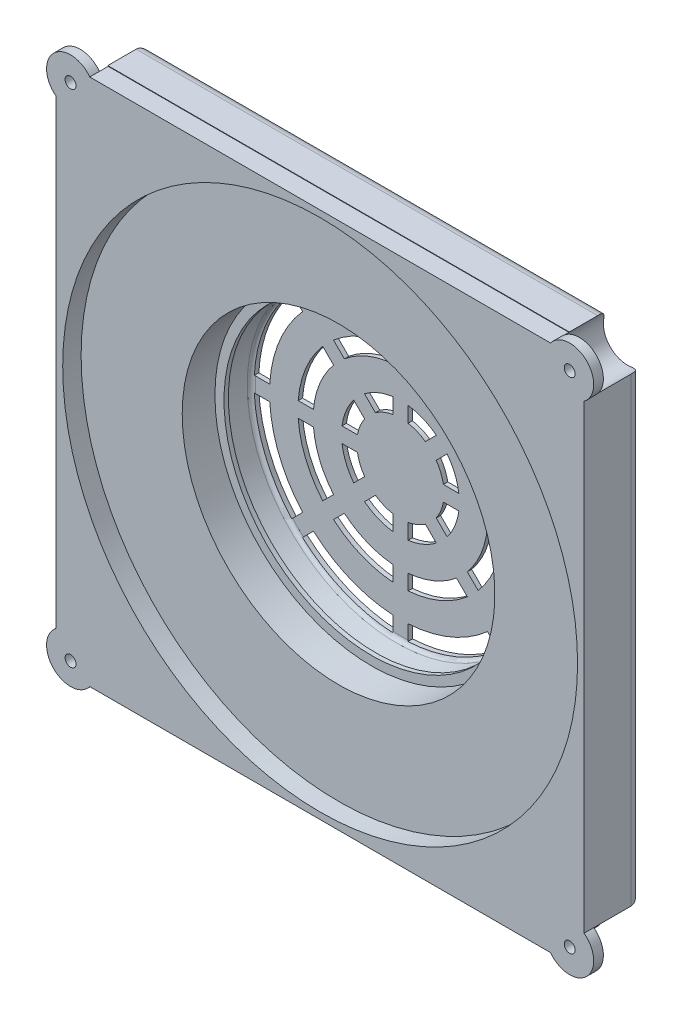
from build123d import *
from build123d.topology import SkipClean

# Parameters (mm, degrees)
SKETCH2_R                 = 118
BOSS_EXTRUDE8_DEPTH       = 20
SKETCH4_R                 = 11
CUT_EXTRUDE3_DEPTH        = 15
SKETCH5_R                 = 2.5
CUT_EXTRUDE4_DEPTH        = 75
CUT_EXTRUDE5_DEPTH        = 59
CUT_EXTRUDE5_DEPTH_BACK   = 200
SKETCH7_W                 = 242
SKETCH7_H                 = 242.45858824
BOSS_EXTRUDE9_DEPTH       = 2
SKETCH8_R                 = 67.5
CUT_EXTRUDE7_DEPTH        = 2
BOSS_EXTRUDE12_DEPTH      = 1
BOSS_EXTRUDE12_DEPTH_BACK = 17
SKETCH9_R                 = 71.662772412
SKETCH10_R                = 11
CUT_EXTRUDE11_DEPTH       = 22
FILLET5_START             = -107
FILLET5_DEPTH             = 214
FILLET5_2_DEPTH           = 214


with BuildPart() as part:
    # Sketch1 → Revolve9 (revolve)
    with BuildSketch(Plane(origin=(0, 0, 0), x_dir=(1, 0, 0), z_dir=(0, 1, 0)), mode=Mode.PRIVATE) as revolve9_sk:
        with BuildLine():
            Line((0, 21.542790465), (68.233380787, 21.542790465))
            ThreePointArc((68.233380787, 21.542790465), (69.55743015, 21.041754536), (70.21808321, 19.78968375))
            Line((70.21808321, 19.78968375), (71.662772412, 8.176252615))
            Line((71.662772412, 8.176252615), (118, 8.176252615))
            ThreePointArc((118, 8.176252615), (119.414213562, 7.590466178), (120, 6.176252615))
            Line((120, 6.176252615), (120, 2.737923598))
            Line((120, 2.737923598), (118, 2.737923598))
            Line((118, 2.737923598), (118, 6.176252615))
            Line((118, 6.176252615), (69.896153199, 6.176252615))
            Line((69.896153199, 6.176252615), (68.451463998, 17.78968375))
            ThreePointArc((68.451463998, 17.78968375), (67.790810938, 19.041754536), (66.466761575, 19.542790465))
            Line((66.466761575, 19.542790465), (0, 19.542790465))
            Line((0, 19.542790465), (0, 21.542790465))
        make_face()
    revolve(revolve9_sk.sketch.rotate(Axis((0, 0, -66.796199367), (0, 0, 1)), 180), axis=Axis((0, 0, -66.796199367), (0, 0, 1)))

    # Sketch2 → Boss-Extrude8 (add)
    with BuildSketch(Plane.XY.offset(-2.737923598)):
        with BuildLine():
            Line((-121, -105.598353442), (-121, 105.598353442))
            ThreePointArc((-121, 105.598353442), (-122.171572875, 122.171572875), (-105.598353442, 121))
            Line((-105.598353442, 121), (105.598353442, 121))
            ThreePointArc((105.598353442, 121), (122.171572875, 122.171572875), (121, 105.598353442))
            Line((121, 105.598353442), (121, -105.598353442))
            ThreePointArc((121, -105.598353442), (122.171572875, -122.171572875), (105.598353442, -121))
            Line((105.598353442, -121), (-105.598353442, -121))
            ThreePointArc((-105.598353442, -121), (-122.171572875, -122.171572875), (-121, -105.598353442))
        make_face()
        with Locations(Location((0, 0, 0), (0, 0, 180))):
            Circle(SKETCH2_R, mode=Mode.SUBTRACT)
    extrude(amount=BOSS_EXTRUDE8_DEPTH)

    # Sketch4 → Cut-Extrude3 (cut)
    with BuildSketch(Plane(origin=(0, 0, -2.737923598), x_dir=(-1, 0, 0), z_dir=(0, 0, -1))):
        with Locations((-114.393398282, 114.393398282)):
            Circle(SKETCH4_R)
        with Locations((-114.393398282, -115.202418497)):
            Circle(SKETCH4_R)
        with Locations((114.393398282, 114.393398282)):
            Circle(SKETCH4_R)
        with Locations((114.393398282, -115.202418497)):
            Circle(SKETCH4_R)
    extrude(amount=-CUT_EXTRUDE3_DEPTH, mode=Mode.SUBTRACT)

    # Sketch5 → Cut-Extrude4 (cut)
    with BuildSketch(Plane(origin=(0, 0, 12.262076402), x_dir=(-1, 0, 0), z_dir=(0, 0, -1))):
        with Locations((-114.393398282, 114.393398282)):
            Circle(SKETCH5_R)
        with Locations((114.393398282, 114.393398282)):
            Circle(SKETCH5_R)
        with Locations((-114.393398282, -114.393398282)):
            Circle(SKETCH5_R)
        with Locations((114.393398282, -115.202418497)):
            Circle(SKETCH5_R)
    extrude(amount=-CUT_EXTRUDE4_DEPTH, mode=Mode.SUBTRACT)

    # Sketch6 → Cut-Extrude5 (cut, two sides: drawn at the far end of the back side and taken through both)
    with BuildSketch(Plane(origin=(0, 0, -21.542790465), x_dir=(-1, 0, 0), z_dir=(0, 0, -1)).offset(-CUT_EXTRUDE5_DEPTH_BACK)):
        with BuildLine():
            Line((39.879287809, 44.829035277), (44.83659422, 49.786341689))
            ThreePointArc((44.83659422, 49.786341689), (25.639789968, 61.899928678), (3.5, 66.908519637))
            Line((3.5, 66.908519637), (3.5, 59.897829677))
            ThreePointArc((3.5, 59.897829677), (22.961005942, 55.432771951), (39.879287809, 44.829035277))
        make_face()
        with BuildLine():
            Line((59.897829677, 3.5), (66.908519637, 3.5))
            ThreePointArc((66.908519637, 3.5), (61.899928678, 25.639789968), (49.786341689, 44.83659422))
            Line((49.786341689, 44.83659422), (44.829035277, 39.879287809))
            ThreePointArc((44.829035277, 39.879287809), (55.432771951, 22.961005942), (59.897829677, 3.5))
        make_face()
        with BuildLine():
            ThreePointArc((25.700913744, 30.650661212), (15.307337295, 36.9551813), (3.5, 39.846580782))
            Line((3.5, 39.846580782), (3.5, 46.869499677))
            ThreePointArc((3.5, 46.869499677), (17.986121321, 43.422338028), (30.666867318, 35.616614787))
            Line((30.666867318, 35.616614787), (25.700913744, 30.650661212))
        make_face()
        with BuildLine():
            ThreePointArc((39.846580782, 3.5), (36.9551813, 15.307337295), (30.650661212, 25.700913744))
            Line((30.650661212, 25.700913744), (35.616614787, 30.666867318))
            ThreePointArc((35.616614787, 30.666867318), (43.422338028, 17.986121321), (46.869499677, 3.5))
            Line((46.869499677, 3.5), (39.846580782, 3.5))
        make_face()
        with BuildLine():
            ThreePointArc((-3.5, 39.846580782), (-15.307337295, 36.9551813), (-25.700913744, 30.650661212))
            Line((-25.700913744, 30.650661212), (-30.666867318, 35.616614787))
            ThreePointArc((-30.666867318, 35.616614787), (-17.986121321, 43.422338028), (-3.5, 46.869499677))
            Line((-3.5, 46.869499677), (-3.5, 39.846580782))
        make_face()
        with BuildLine():
            Line((-3.5, 59.897829677), (-3.5, 66.908519637))
            ThreePointArc((-3.5, 66.908519637), (-25.639789968, 61.899928678), (-44.83659422, 49.786341689))
            Line((-44.83659422, 49.786341689), (-39.879287809, 44.829035277))
            ThreePointArc((-39.879287809, 44.829035277), (-22.961005942, 55.432771951), (-3.5, 59.897829677))
        make_face()
        with BuildLine():
            Line((-30.650661212, 25.700913744), (-35.616614787, 30.666867318))
            ThreePointArc((-35.616614787, 30.666867318), (-43.422338028, 17.986121321), (-46.869499677, 3.5))
            Line((-46.869499677, 3.5), (-39.846580782, 3.5))
            ThreePointArc((-39.846580782, 3.5), (-36.9551813, 15.307337295), (-30.650661212, 25.700913744))
        make_face()
        with BuildLine():
            ThreePointArc((-39.846580782, -3.5), (-36.9551813, -15.307337295), (-30.650661212, -25.700913744))
            Line((-30.650661212, -25.700913744), (-35.616614787, -30.666867318))
            ThreePointArc((-35.616614787, -30.666867318), (-43.422338028, -17.986121321), (-46.869499677, -3.5))
            Line((-46.869499677, -3.5), (-39.846580782, -3.5))
        make_face()
        with BuildLine():
            Line((-59.897829677, -3.5), (-66.908519637, -3.5))
            ThreePointArc((-66.908519637, -3.5), (-61.899928678, -25.639789968), (-49.786341689, -44.83659422))
            Line((-49.786341689, -44.83659422), (-44.829035277, -39.879287809))
            ThreePointArc((-44.829035277, -39.879287809), (-55.432771951, -22.961005942), (-59.897829677, -3.5))
        make_face()
        with BuildLine():
            ThreePointArc((-19.691368668, -3.5), (-18.47759065, -7.653668647), (-16.39877405, -11.449026581))
            Line((-16.39877405, -11.449026581), (-21.405668752, -16.455921283))
            ThreePointArc((-21.405668752, -16.455921283), (-24.944747378, -10.332452674), (-26.77218706, -3.5))
            Line((-26.77218706, -3.5), (-19.691368668, -3.5))
        make_face()
        with BuildLine():
            ThreePointArc((-16.39877405, 11.449026581), (-18.47759065, 7.653668647), (-19.691368668, 3.5))
            Line((-19.691368668, 3.5), (-26.77218706, 3.5))
            ThreePointArc((-26.77218706, 3.5), (-24.944747378, 10.332452674), (-21.405668752, 16.455921283))
            Line((-21.405668752, 16.455921283), (-16.39877405, 11.449026581))
        make_face()
        with BuildLine():
            ThreePointArc((19.691368668, 3.5), (18.47759065, 7.653668647), (16.39877405, 11.449026581))
            Line((16.39877405, 11.449026581), (21.405668752, 16.455921283))
            ThreePointArc((21.405668752, 16.455921283), (24.944747378, 10.332452674), (26.77218706, 3.5))
            Line((26.77218706, 3.5), (19.691368668, 3.5))
        make_face()
        with BuildLine():
            Line((-44.829035277, 39.879287809), (-49.786341689, 44.83659422))
            ThreePointArc((-49.786341689, 44.83659422), (-61.899928678, 25.639789968), (-66.908519637, 3.5))
            Line((-66.908519637, 3.5), (-59.897829677, 3.5))
            ThreePointArc((-59.897829677, 3.5), (-55.432771951, 22.961005942), (-44.829035277, 39.879287809))
        make_face()
        with BuildLine():
            ThreePointArc((-11.449026581, -16.39877405), (-7.653668647, -18.47759065), (-3.5, -19.691368668))
            Line((-3.5, -19.691368668), (-3.5, -26.77218706))
            ThreePointArc((-3.5, -26.77218706), (-10.332452674, -24.944747378), (-16.455921283, -21.405668752))
            Line((-16.455921283, -21.405668752), (-11.449026581, -16.39877405))
        make_face()
        with BuildLine():
            ThreePointArc((3.5, -19.691368668), (7.653668647, -18.47759065), (11.449026581, -16.39877405))
            Line((11.449026581, -16.39877405), (16.455921283, -21.405668752))
            ThreePointArc((16.455921283, -21.405668752), (10.332452674, -24.944747378), (3.5, -26.77218706))
            Line((3.5, -26.77218706), (3.5, -19.691368668))
        make_face()
        with BuildLine():
            ThreePointArc((16.39877405, -11.449026581), (18.47759065, -7.653668647), (19.691368668, -3.5))
            Line((19.691368668, -3.5), (26.77218706, -3.5))
            ThreePointArc((26.77218706, -3.5), (24.944747378, -10.332452674), (21.405668752, -16.455921283))
            Line((21.405668752, -16.455921283), (16.39877405, -11.449026581))
        make_face()
        with BuildLine():
            ThreePointArc((30.650661212, -25.700913744), (36.9551813, -15.307337295), (39.846580782, -3.5))
            Line((39.846580782, -3.5), (46.869499677, -3.5))
            ThreePointArc((46.869499677, -3.5), (43.422338028, -17.986121321), (35.616614787, -30.666867318))
            Line((35.616614787, -30.666867318), (30.650661212, -25.700913744))
        make_face()
        with BuildLine():
            ThreePointArc((3.5, -39.846580782), (15.307337295, -36.9551813), (25.700913744, -30.650661212))
            Line((25.700913744, -30.650661212), (30.666867318, -35.616614787))
            ThreePointArc((30.666867318, -35.616614787), (17.986121321, -43.422338028), (3.5, -46.869499677))
            Line((3.5, -46.869499677), (3.5, -39.846580782))
        make_face()
        with BuildLine():
            ThreePointArc((-25.700913744, -30.650661212), (-15.307337295, -36.9551813), (-3.5, -39.846580782))
            Line((-3.5, -39.846580782), (-3.5, -46.869499677))
            ThreePointArc((-3.5, -46.869499677), (-17.986121321, -43.422338028), (-30.666867318, -35.616614787))
            Line((-30.666867318, -35.616614787), (-25.700913744, -30.650661212))
        make_face()
        with BuildLine():
            Line((-39.879287809, -44.829035277), (-44.83659422, -49.786341689))
            ThreePointArc((-44.83659422, -49.786341689), (-25.639789968, -61.899928678), (-3.5, -66.908519637))
            Line((-3.5, -66.908519637), (-3.5, -59.897829677))
            ThreePointArc((-3.5, -59.897829677), (-22.961005942, -55.432771951), (-39.879287809, -44.829035277))
        make_face()
        with BuildLine():
            Line((3.5, -59.897829677), (3.5, -66.908519637))
            ThreePointArc((3.5, -66.908519637), (25.639789968, -61.899928678), (44.83659422, -49.786341689))
            Line((44.83659422, -49.786341689), (39.879287809, -44.829035277))
            ThreePointArc((39.879287809, -44.829035277), (22.961005942, -55.432771951), (3.5, -59.897829677))
        make_face()
        with BuildLine():
            Line((44.829035277, -39.879287809), (49.786341689, -44.83659422))
            ThreePointArc((49.786341689, -44.83659422), (61.899928678, -25.639789968), (66.908519637, -3.5))
            Line((66.908519637, -3.5), (59.897829677, -3.5))
            ThreePointArc((59.897829677, -3.5), (55.432771951, -22.961005942), (44.829035277, -39.879287809))
        make_face()
        with BuildLine():
            ThreePointArc((-3.5, 19.691368668), (-7.653668647, 18.47759065), (-11.449026581, 16.39877405))
            Line((-11.449026581, 16.39877405), (-16.455921283, 21.405668752))
            ThreePointArc((-16.455921283, 21.405668752), (-10.332452674, 24.944747378), (-3.5, 26.77218706))
            Line((-3.5, 26.77218706), (-3.5, 19.691368668))
        make_face()
        with BuildLine():
            ThreePointArc((11.449026581, 16.39877405), (7.653668647, 18.47759065), (3.5, 19.691368668))
            Line((3.5, 19.691368668), (3.5, 26.77218706))
            ThreePointArc((3.5, 26.77218706), (10.332452674, 24.944747378), (16.455921283, 21.405668752))
            Line((16.455921283, 21.405668752), (11.449026581, 16.39877405))
        make_face()
    extrude(amount=CUT_EXTRUDE5_DEPTH + CUT_EXTRUDE5_DEPTH_BACK, mode=Mode.SUBTRACT)

    # Sketch7 → Boss-Extrude9 (add)
    with BuildSketch(Plane.XY.offset(-6.176252615)):
        Rectangle(SKETCH7_W, SKETCH7_H)
    extrude(amount=-BOSS_EXTRUDE9_DEPTH)

    # Sketch8 → Cut-Extrude7 (cut)
    with BuildSketch(Plane.XY.offset(-6.176252615)):
        Circle(SKETCH8_R)
    extrude(amount=-CUT_EXTRUDE7_DEPTH, mode=Mode.SUBTRACT)

    # Sketch9 → Boss-Extrude12 (add, two sides: drawn at the far end of the back side and taken through both)
    with BuildSketch(Plane(origin=(0, 0, -8.176252615), x_dir=(-1, 0, 0), z_dir=(0, 0, -1)).offset(-BOSS_EXTRUDE12_DEPTH_BACK)):
        with BuildLine():
            Line((-105.775363234, -121.22929412), (105.775363234, -121.22929412))
            ThreePointArc((105.775363234, -121.22929412), (106.51348441, -106.718311483), (121, -105.598353442))
            Line((121, -105.598353442), (121, 105.598353442))
            ThreePointArc((121, 105.598353442), (106.51348441, 106.718311483), (105.775363234, 121.22929412))
            Line((105.775363234, 121.22929412), (-105.775363234, 121.22929412))
            ThreePointArc((-105.775363234, 121.22929412), (-106.51348441, 106.718311483), (-121, 105.598353442))
            Line((-121, 105.598353442), (-121, -105.598353442))
            ThreePointArc((-121, -105.598353442), (-106.51348441, -106.718311483), (-105.775363234, -121.22929412))
        make_face()
        with Locations(Location((0, 0, 0), (0, 0, 180))):
            Circle(SKETCH9_R, mode=Mode.SUBTRACT)
    extrude(amount=BOSS_EXTRUDE12_DEPTH + BOSS_EXTRUDE12_DEPTH_BACK)

    # Sketch10 → Cut-Extrude11 (cut)
    with SkipClean():  # the faces are left unmerged after this step: merging them gives an invalid solid
        with BuildSketch(Plane(origin=(0, 0, -9.176252615), x_dir=(-1, 0, 0), z_dir=(0, 0, -1))):
            with Locations((-114.393398282, 114.393398282)):
                Circle(SKETCH10_R)
            with Locations((114.393398282, 114.393398282)):
                Circle(SKETCH10_R)
            with Locations((-114.393398282, -114.393398282)):
                Circle(SKETCH10_R)
            with Locations((114.393398282, -114.393398282)):
                Circle(SKETCH10_R)
        extrude(amount=-CUT_EXTRUDE11_DEPTH, mode=Mode.SUBTRACT)

    # Fillet5: read off the stored shape, not the designer's step
    # Fillet5 outline → Fillet5 (cut)
    with SkipClean():  # the faces are left unmerged after this step: merging them gives an invalid solid
        with BuildSketch(Plane(origin=(0, 0, 0), x_dir=(1, 0, 0), z_dir=(0, 1, 0)).offset(FILLET5_START)):
            with BuildLine():
                Line((121, 9.176252615), (116, 9.176252615))
                ThreePointArc((116, 9.176252615), (119.535533906, 7.711786521), (121, 4.176252615))
                Line((121, 4.176252615), (121, 9.176252615))
            make_face()
            with BuildLine():
                ThreePointArc((-121, 4.176252615), (-119.535533906, 7.711786521), (-116, 9.176252615))
                Line((-116, 9.176252615), (-121, 9.176252615))
                Line((-121, 9.176252615), (-121, 4.176252615))
            make_face()
        extrude(amount=FILLET5_DEPTH, mode=Mode.SUBTRACT)

    # Fillet5 2 outline → Fillet5 2 (cut)
    with SkipClean():  # the faces are left unmerged after this step: merging them gives an invalid solid
        with BuildSketch(Plane.YZ.offset(FILLET5_START)):
            with BuildLine():
                Line((-121.22929412, -9.176252615), (-116.22929412, -9.176252615))
                ThreePointArc((-116.22929412, -9.176252615), (-119.764828026, -7.711786521), (-121.22929412, -4.176252615))
                Line((-121.22929412, -4.176252615), (-121.22929412, -9.176252615))
            make_face()
            with BuildLine():
                ThreePointArc((121.22929412, -4.176252615), (119.764828026, -7.711786521), (116.22929412, -9.176252615))
                Line((116.22929412, -9.176252615), (121.22929412, -9.176252615))
                Line((121.22929412, -9.176252615), (121.22929412, -4.176252615))
            make_face()
        extrude(amount=FILLET5_2_DEPTH, mode=Mode.SUBTRACT)


solid = part.part
